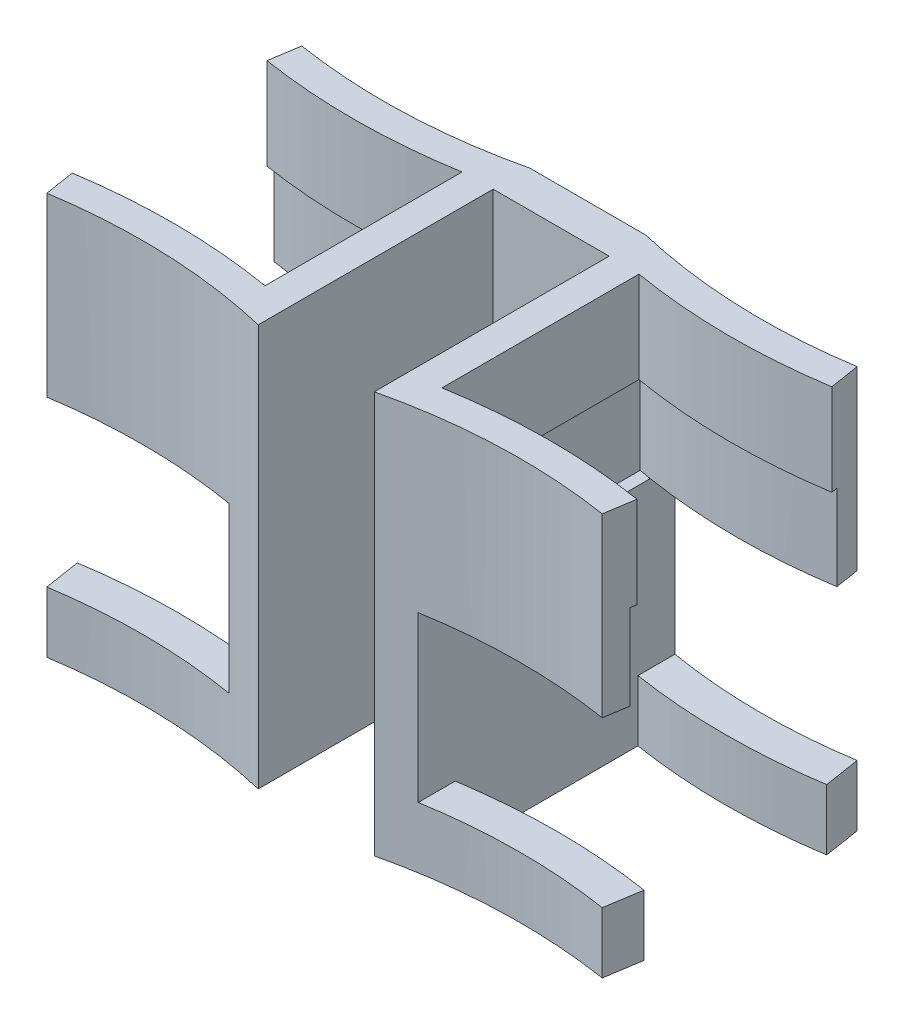
from build123d import *

# Parameters (mm, degrees)
BOSS_EXTRUDE1_DEPTH = 66
CUT_EXTRUDE1_START  = -15
CUT_EXTRUDE1_DEPTH  = 15
CUT_EXTRUDE2_START  = -14
CUT_EXTRUDE2_DEPTH  = 14
SKETCH4_W           = 44.566501288
SKETCH4_H           = 27
CUT_EXTRUDE3_DEPTH  = 99.455967425
SKETCH5_W           = 44.566501288
SKETCH5_H           = 27
CUT_EXTRUDE4_DEPTH  = 99.455967425


with BuildPart() as part:
    # Sketch1 → Boss-Extrude1 (new body)
    with BuildSketch(Plane(origin=(0, 0, 0), x_dir=(1, 0, 0), z_dir=(0, 1, 0))):
        with BuildLine():
            Line((-6, -1.283250644), (-6, -31.283250644))
            ThreePointArc((-6, -31.283250644), (-21.5, -30.074697642), (-37, -31.283250644))
            Line((-37, -31.283250644), (-36.07, -37.210737464))
            ThreePointArc((-36.07, -37.210737464), (-17.969313256, -36.14102822), (0, -38.566501288))
            Line((0, -38.566501288), (0, 0))
            Line((0, 0), (19.05, 0))
            Line((19.05, 0), (19.05, -38.566501288))
            ThreePointArc((19.05, -38.566501288), (37.019313256, -36.14102822), (55.12, -37.210737464))
            Line((55.12, -37.210737464), (56.05, -31.283250644))
            ThreePointArc((56.05, -31.283250644), (40.55, -30.074697642), (25.05, -31.283250644))
            Line((25.05, -31.283250644), (25.05, -1.283250644))
            ThreePointArc((25.05, -1.283250644), (40.55, -2.491803646), (56.05, -1.283250644))
            Line((56.05, -1.283250644), (55.12, 4.644236176))
            ThreePointArc((55.12, 4.644236176), (37.019313256, 3.574526932), (19.05, 6))
            Line((19.05, 6), (0, 6))
            ThreePointArc((0, 6), (-17.969313256, 3.574526932), (-36.07, 4.644236176))
            Line((-36.07, 4.644236176), (-37, -1.283250644))
            ThreePointArc((-37, -1.283250644), (-21.5, -2.491803646), (-6, -1.283250644))
        make_face()
    extrude(amount=BOSS_EXTRUDE1_DEPTH)

    # Sketch2 → Cut-Extrude1 (cut)
    # profile 1 of 2: a face of its own
    with BuildSketch(Plane(origin=(0, 66, 0), x_dir=(1, 0, 0), z_dir=(0, 1, 0)).offset(CUT_EXTRUDE1_START)):
        with BuildLine():
            Line((-5, -0.107120067), (-5, -32.459381221))
            ThreePointArc((-5, -32.459381221), (-21.5, -31.074697642), (-38, -32.459381221))
            Line((-38, -32.459381221), (-38, -0.107120067))
            ThreePointArc((-38, -0.107120067), (-21.5, -1.491803646), (-5, -0.107120067))
        make_face()
        with BuildLine():
            Line((-6, -1.283250644), (-6, -31.283250644))
            ThreePointArc((-6, -31.283250644), (-21.5, -30.074697642), (-37, -31.283250644))
            Line((-37, -31.283250644), (-37, -1.283250644))
            ThreePointArc((-37, -1.283250644), (-21.5, -2.491803646), (-6, -1.283250644))
        make_face(mode=Mode.SUBTRACT)
    # profile 2 of 2: a face of its own
    with BuildSketch(Plane(origin=(0, 66, 0), x_dir=(1, 0, 0), z_dir=(0, 1, 0)).offset(CUT_EXTRUDE1_START)):
        with BuildLine():
            Line((57.05, -0.107120067), (57.05, -32.459381221))
            ThreePointArc((57.05, -32.459381221), (40.55, -31.074697642), (24.05, -32.459381221))
            Line((24.05, -32.459381221), (24.05, -0.107120067))
            ThreePointArc((24.05, -0.107120067), (40.55, -1.491803646), (57.05, -0.107120067))
        make_face()
        with BuildLine():
            Line((25.05, -1.283250644), (25.05, -31.283250644))
            ThreePointArc((25.05, -31.283250644), (40.55, -30.074697642), (56.05, -31.283250644))
            Line((56.05, -31.283250644), (56.05, -1.283250644))
            ThreePointArc((56.05, -1.283250644), (40.55, -2.491803646), (25.05, -1.283250644))
        make_face(mode=Mode.SUBTRACT)
    extrude(amount=CUT_EXTRUDE1_DEPTH, mode=Mode.SUBTRACT)

    # Sketch3 → Cut-Extrude2 (cut)
    # profile 1 of 2: a face of its own
    with BuildSketch(Plane(origin=(0, 51, 0), x_dir=(1, 0, 0), z_dir=(0, 1, 0)).offset(CUT_EXTRUDE2_START)):
        with BuildLine():
            Line((-4, 1.083355157), (-4, -33.649856445))
            ThreePointArc((-4, -33.649856445), (-21.5, -32.074697642), (-39, -33.649856445))
            Line((-39, -33.649856445), (-39, 1.083355157))
            ThreePointArc((-39, 1.083355157), (-21.5, -0.491803646), (-4, 1.083355157))
        make_face()
        with BuildLine():
            Line((-37, -1.283250644), (-37, -31.283250644))
            ThreePointArc((-37, -31.283250644), (-21.5, -30.074697642), (-6, -31.283250644))
            Line((-6, -31.283250644), (-6, -1.283250644))
            ThreePointArc((-6, -1.283250644), (-21.5, -2.491803646), (-37, -1.283250644))
        make_face(mode=Mode.SUBTRACT)
    # profile 2 of 2: a face of its own
    with BuildSketch(Plane(origin=(0, 51, 0), x_dir=(1, 0, 0), z_dir=(0, 1, 0)).offset(CUT_EXTRUDE2_START)):
        with BuildLine():
            Line((58.05, 1.083355157), (58.05, -33.649856445))
            ThreePointArc((58.05, -33.649856445), (40.55, -32.074697642), (23.05, -33.649856445))
            Line((23.05, -33.649856445), (23.05, 1.083355157))
            ThreePointArc((23.05, 1.083355157), (40.55, -0.491803646), (58.05, 1.083355157))
        make_face()
        with BuildLine():
            Line((25.05, -1.283250644), (25.05, -31.283250644))
            ThreePointArc((25.05, -31.283250644), (40.55, -30.074697642), (56.05, -31.283250644))
            Line((56.05, -31.283250644), (56.05, -1.283250644))
            ThreePointArc((56.05, -1.283250644), (40.55, -2.491803646), (25.05, -1.283250644))
        make_face(mode=Mode.SUBTRACT)
    extrude(amount=CUT_EXTRUDE2_DEPTH, mode=Mode.SUBTRACT)

    # Sketch4 → Cut-Extrude3 (cut, through all)
    with BuildSketch(Plane.ZY.offset(6)):
        with Locations((16.283250644, 23.5)):
            Rectangle(SKETCH4_W, SKETCH4_H)
    extrude(amount=CUT_EXTRUDE3_DEPTH, mode=Mode.SUBTRACT)

    # Sketch5 → Cut-Extrude4 (cut, through all)
    with BuildSketch(Plane(origin=(25.05, 0, 0), x_dir=(0, 0, -1), z_dir=(1, 0, 0))):
        with Locations((-16.283250644, 23.5)):
            Rectangle(SKETCH5_W, SKETCH5_H)
    extrude(amount=CUT_EXTRUDE4_DEPTH, mode=Mode.SUBTRACT)


solid = part.part
